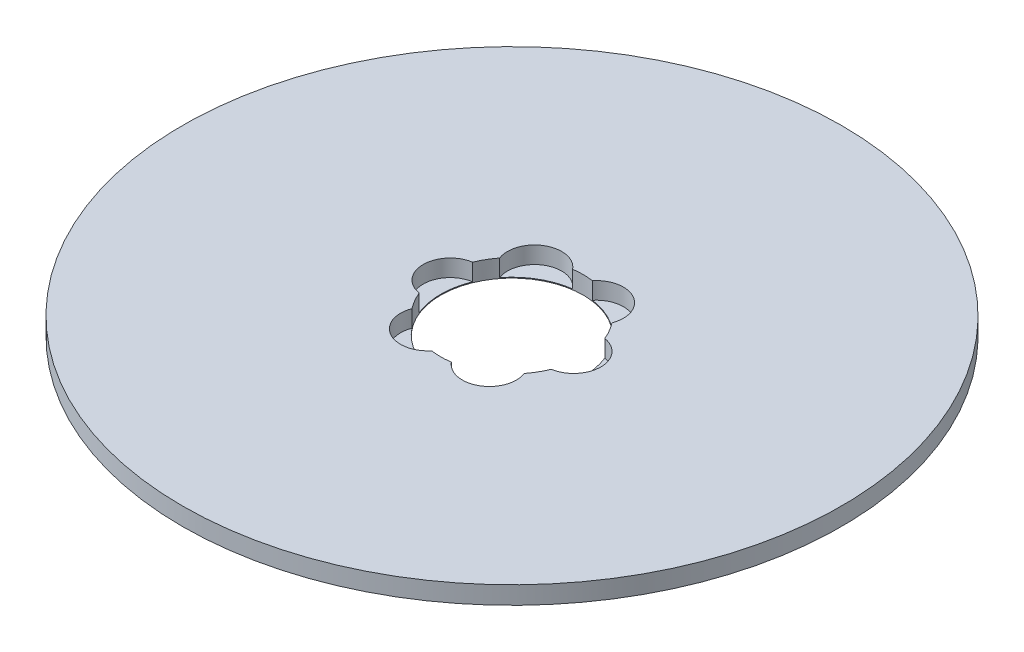
from build123d import *

# Parameters (mm, degrees)
SKETCH1_R           = 92.5
BOSS_EXTRUDE1_DEPTH = 5
SKETCH2_R           = 20
CUT_EXTRUDE1_DEPTH  = 131.910274616
SKETCH3_R           = 7.5961494
CUT_EXTRUDE2_DEPTH  = 4.769934298
CIRPATTERN1_COUNT   = 6


with BuildPart() as part:
    # Sketch1 → Boss-Extrude1 (new body)
    with BuildSketch(Plane(origin=(0, 0, 0), x_dir=(1, 0, 0), z_dir=(0, 1, 0))):
        Circle(SKETCH1_R)
    extrude(amount=BOSS_EXTRUDE1_DEPTH)

    # Sketch2 → Cut-Extrude1 (cut, through all)
    with BuildSketch(Plane(origin=(0, 0, 0), x_dir=(1, 0, 0), z_dir=(0, 1, 0))):
        Circle(SKETCH2_R)
    extrude(amount=CUT_EXTRUDE1_DEPTH, mode=Mode.SUBTRACT)

    # Sketch3 → Cut-Extrude2 (cut)
    with BuildSketch(Plane(origin=(0, 5, 0), x_dir=(1, 0, 0), z_dir=(0, 1, 0))):
        with Locations((-17.330257955, 0)):
            Circle(SKETCH3_R)
    cut_extrude2 = extrude(amount=-CUT_EXTRUDE2_DEPTH, mode=Mode.SUBTRACT)

    # CirPattern1: Cut-Extrude2 ×6 about axis
    cirpattern1_axis = Axis((0, 0, 0), (0, 1, 0))
    for i in range(1, CIRPATTERN1_COUNT):
        add(cut_extrude2.rotate(cirpattern1_axis, i * 360 / CIRPATTERN1_COUNT), mode=Mode.SUBTRACT)


solid = part.part
